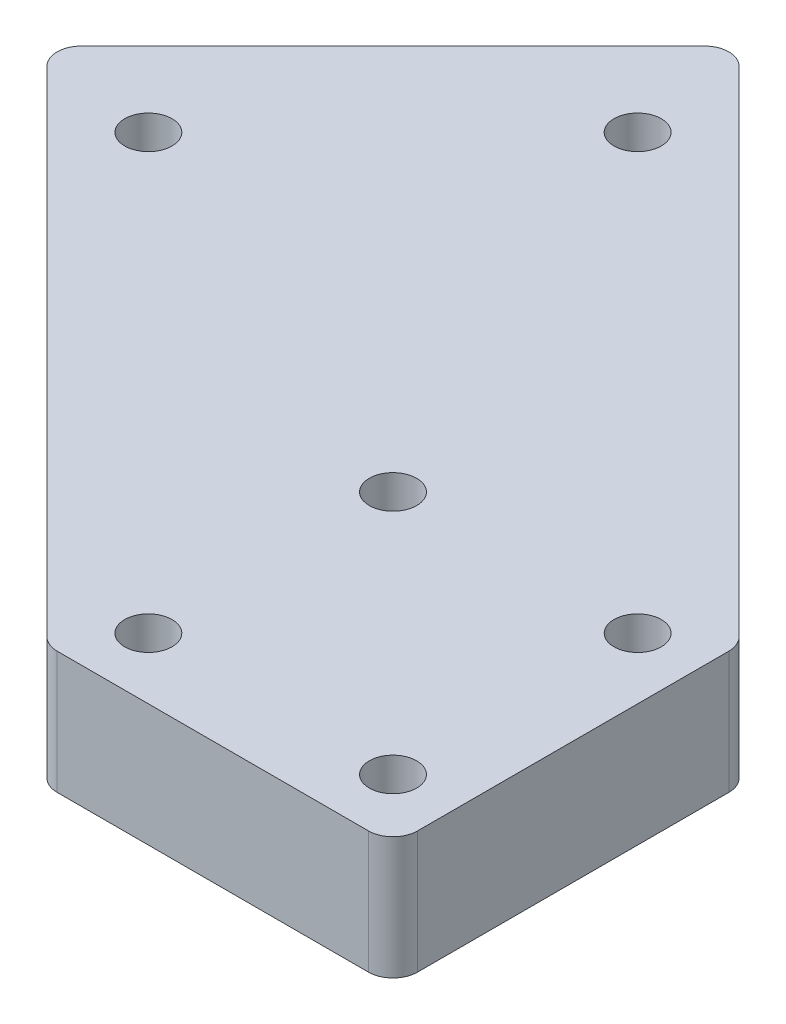
from build123d import *

# Parameters (mm, degrees)
SKETCH3_W             = 35.921024484
SKETCH3_H             = 35.921024484
BOSS_EXTRUDE2_DEPTH   = 12.7
BOSS_EXTRUDE3_DEPTH   = 25.4
F_8_CLEARANCE_HOLE1_D = 4.9149
F_8_CLEARANCE_HOLE2_D = 4.9149
SKETCH10_R            = 3.937
CUT_EXTRUDE1_DEPTH    = 6.35
FILLET1_R             = 2.54


with BuildPart() as part:
    # Sketch3 → Boss-Extrude2 (new body)
    with BuildSketch(Plane(origin=(0, 0, 0), x_dir=(1, 0, 0), z_dir=(0, 1, 0))):
        with Locations((17.960512242, -17.960512242)):
            Rectangle(SKETCH3_W, SKETCH3_H)
    extrude(amount=BOSS_EXTRUDE2_DEPTH)

    # Sketch4 → Boss-Extrude3 (add, symmetric)
    with BuildSketch(Plane(origin=(0, 0, 0), x_dir=(0.7071067811865476, 0, 0.7071067811865475), z_dir=(-0.7071067811865475, 0, 0.7071067811865476))):
        Polygon((25.4, 12.7), (-25.4, 12.7), (-50.8, 12.7), (-50.8, 0), (0, 0), (25.4, 0), align=None)
    extrude(amount=BOSS_EXTRUDE3_DEPTH, both=True)

    # #8 Clearance Hole1 (through all)
    with Locations(Plane(origin=(0, 0, 0), x_dir=(-1, 0, 0), z_dir=(0, -1, 0))):
        with Locations((-29.571024484, -29.571024484), (-4.171024484, -4.171024484), (-29.571024484, -4.171024484), (-4.171024484, -29.571024484)):
            Hole(F_8_CLEARANCE_HOLE1_D / 2)

    # #8 Clearance Hole2 (through all)
    with Locations(Plane(origin=(0, 12.7, 0), x_dir=(1, 0, 0), z_dir=(0, 1, 0))):
        with Locations((-40.855979707, 15.459815396), (-15.459815396, 40.855979707)):
            Hole(F_8_CLEARANCE_HOLE2_D / 2)

    # Sketch10 → Cut-Extrude1 (cut)
    with BuildSketch(Plane.XZ):
        with Locations((-40.855979707, -15.459815396)):
            Circle(SKETCH10_R)
        with Locations((-15.459815396, -40.855979707)):
            Circle(SKETCH10_R)
    extrude(amount=-CUT_EXTRUDE1_DEPTH, mode=Mode.SUBTRACT)

    # Fillet1
    fillet1_edges = [part.edges().sort_by_distance(p)[0] for p in [
        (-17.960512242, 6.35, -53.881536726),
        (-53.881536726, 6.35, -17.960512242),
        (35.921024484, 6.35, 0),
        (35.921024484, 6.35, 35.921024484),
        (0, 6.35, 35.921024484),
    ]]
    fillet(fillet1_edges, radius=FILLET1_R)


solid = part.part
